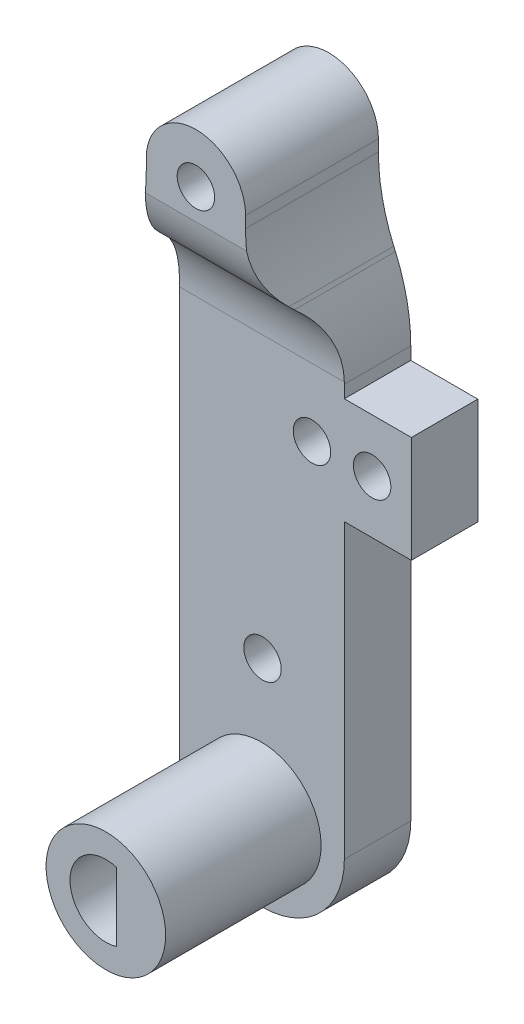
from build123d import *

# Parameters (mm, degrees)
SKETCH1_R           = 1.7907
BOSS_EXTRUDE1_DEPTH = 12.7
CUT_EXTRUDE1_DEPTH  = 43.908371508
SKETCH6_R           = 5.715
BOSS_EXTRUDE2_DEPTH = 14.859


with BuildPart() as part:
    # Sketch1 → Boss-Extrude1 (new body)
    with BuildSketch(Plane.XY):
        with BuildLine():
            ThreePointArc((-5.89797239, 28.334249775), (-10.644578231, 33.080855616), (-15.391184073, 28.334249775))
            Line((-15.391184073, 28.334249775), (-15.391184073, 27.2867057))
            ThreePointArc((-15.391184073, 27.2867057), (-15.767187067, 23.64949685), (-16.879292984, 20.16612393))
            Line((-16.879292984, 20.16612393), (-17.078075162, 19.711310306))
            ThreePointArc((-17.078075162, 19.711310306), (-18.190181079, 16.227937386), (-18.566184073, 12.590728536))
            Line((-18.566184073, 12.590728536), (-18.566184073, -26.593250225))
            ThreePointArc((-18.566184073, -26.593250225), (-10.68587239, -34.473561908), (-2.805560707, -26.593250225))
            Line((-2.805560707, -26.593250225), (-2.805560707, 1.359449775))
            Line((-2.805560707, 1.359449775), (3.60162761, 1.359449775))
            Line((3.60162761, 1.359449775), (3.60162761, 11.531317118))
            Line((3.60162761, 11.531317118), (-2.805560707, 11.531317118))
            Line((-2.805560707, 11.531317118), (-2.805560707, 12.738028185))
            ThreePointArc((-2.805560707, 12.738028185), (-3.176236758, 16.349653807), (-4.272809259, 19.810689652))
            Line((-4.272809259, 19.810689652), (-4.430723837, 20.174911983))
            ThreePointArc((-4.430723837, 20.174911983), (-5.527296339, 23.635947828), (-5.89797239, 27.24757345))
            Line((-5.89797239, 27.24757345), (-5.89797239, 28.334249775))
        make_face()
        with Locations((-10.644578231, 28.334249775)):
            Circle(SKETCH1_R, mode=Mode.SUBTRACT)
        with Locations((-0.151184073, 6.451317118)):
            Circle(SKETCH1_R, mode=Mode.SUBTRACT)
        with Locations((-10.628684073, -13.868682882)):
            Circle(SKETCH1_R, mode=Mode.SUBTRACT)
        with Locations((-5.89797239, 6.451317118)):
            Circle(SKETCH1_R, mode=Mode.SUBTRACT)
    extrude(amount=BOSS_EXTRUDE1_DEPTH)

    # Sketch5 → Cut-Extrude1 (cut, through all)
    with BuildSketch(Plane.ZY.offset(18.566184073)):
        with BuildLine():
            Line((6.35, -34.473561908), (12.7, -34.473561908))
            Line((12.7, -34.473561908), (12.7, 25.42988919))
            ThreePointArc((12.7, 25.42988919), (11.822010359, 22.572567989), (10.034713152, 20.176588242))
            Line((10.034713152, 20.176588242), (9.085556584, 19.277178576))
            ThreePointArc((9.085556584, 19.277178576), (7.062886471, 16.378410923), (6.35, 12.916353561))
            Line((6.35, 12.916353561), (6.35, -34.473561908))
        make_face()
    extrude(amount=-CUT_EXTRUDE1_DEPTH, mode=Mode.SUBTRACT)

    # Sketch6 → Boss-Extrude2 (add)
    with BuildSketch(Plane.XY.offset(6.35)):
        with Locations((-10.743060707, -26.568682882)):
            Circle(SKETCH6_R)
        with BuildLine():
            Line((-9.727060707, -23.293658454), (-9.727060707, -29.843707309))
            ThreePointArc((-9.727060707, -29.843707309), (-14.172060707, -26.568682882), (-9.727060707, -23.293658454))
        make_face(mode=Mode.SUBTRACT)
    extrude(amount=BOSS_EXTRUDE2_DEPTH)


solid = part.part
